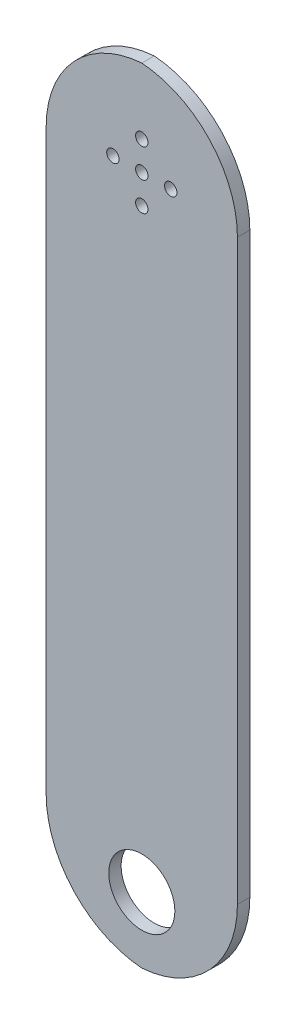
from build123d import *

# Parameters (mm, degrees)
SKETCH1_W           = 46.3
SKETCH1_H           = 189.86
SKETCH1_R           = 10.5
SKETCH1_R_2         = 8
SKETCH1_R_3         = 1.5
BOSS_EXTRUDE1_DEPTH = 3
FILLET1_R           = 25


with BuildPart() as part:
    # Sketch1 → Boss-Extrude1 (new body)
    # profile 1 of 2: a face of its own
    with BuildSketch(Plane.XY):
        Rectangle(SKETCH1_W, SKETCH1_H)
        with Locations((0, 71.93)):
            Circle(SKETCH1_R, mode=Mode.SUBTRACT)
        with Locations((0, -78.93)):
            Circle(SKETCH1_R_2, mode=Mode.SUBTRACT)
    # profile 2 of 2: a face of its own
    with BuildSketch(Plane.XY):
        with Locations((0, 71.93)):
            Circle(SKETCH1_R)
        with Locations((0, 78.93)):
            Circle(SKETCH1_R_3, mode=Mode.SUBTRACT)
        with Locations((7, 71.93)):
            Circle(SKETCH1_R_3, mode=Mode.SUBTRACT)
        with Locations((0, 64.93)):
            Circle(SKETCH1_R_3, mode=Mode.SUBTRACT)
        with Locations((-7, 71.93)):
            Circle(SKETCH1_R_3, mode=Mode.SUBTRACT)
        with Locations((0, 71.93)):
            Circle(SKETCH1_R_3, mode=Mode.SUBTRACT)
    extrude(amount=BOSS_EXTRUDE1_DEPTH)

    # Fillet1
    # the kernel refuses this fillet: 25 mm, written as the material it takes off along each edge
    with BuildSketch(Plane(origin=(-23.15, -94.93, -62.5), x_dir=(0, 1, 0), z_dir=(0, 0, 1)), Plane(origin=(23.15, -94.93, -62.5), x_dir=(-1, 0, 0), z_dir=(0, 0, 1))) as fillet1_piece_1:
        with BuildLine():
            CenterArc((FILLET1_R, -FILLET1_R), FILLET1_R, 90, 90)
            Line((0, -FILLET1_R), (0, 0))
            Line((0, 0), (FILLET1_R, 0))
        make_face()
    extrude(amount=128, mode=Mode.SUBTRACT)
    with BuildSketch(Plane(origin=(-23.15, 94.93, -62.5), x_dir=(0, -1, 0), z_dir=(0, 0, 1)), Plane(origin=(23.15, 94.93, -62.5), x_dir=(-1, 0, 0), z_dir=(0, 0, 1))) as fillet1_piece_2:
        with BuildLine():
            CenterArc((FILLET1_R, FILLET1_R), FILLET1_R, 180, 90)
            Line((0, FILLET1_R), (0, 0))
            Line((0, 0), (FILLET1_R, 0))
        make_face()
    extrude(amount=128, mode=Mode.SUBTRACT)


solid = part.part
